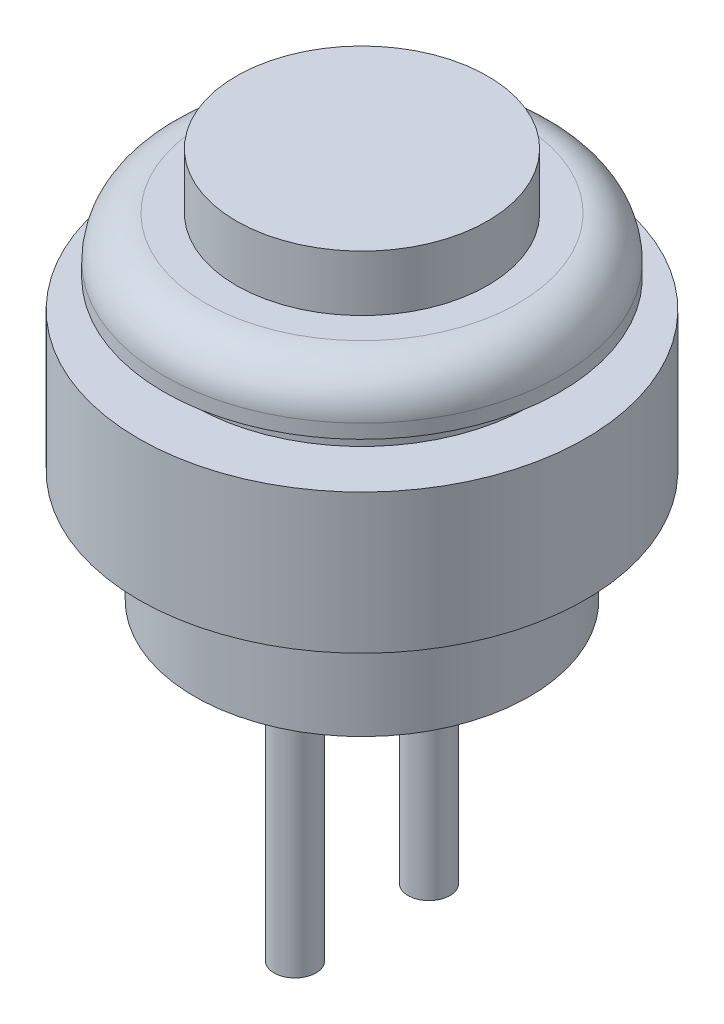
from build123d import *

# Parameters (mm, degrees)
SKETCH_1_R      = 7.1
EXTRUDE_1_DEPTH = 2
FILLET_1_R      = 1.5
SKETCH_2_R      = 4.5
EXTRUDE_2_DEPTH = 2
SKETCH_3_R      = 6
EXTRUDE_3_DEPTH = 10
SKETCH_4_R      = 0.75
EXTRUDE_4_DEPTH = 10
SKETCH_5_R      = 8
SKETCH_5_R_2    = 6
EXTRUDE_5_DEPTH = 5


with BuildPart() as part:
    # 草图1 → 拉伸1 (new body)
    with BuildSketch(Plane(origin=(0, 0, 0), x_dir=(1, 0, 0), z_dir=(0, 1, 0))):
        Circle(SKETCH_1_R)
    extrude(amount=EXTRUDE_1_DEPTH)

    # 圆角1
    fillet_1_edges = [part.edges().sort_by_distance(p)[0] for p in [
        (-7.1, 2, 0),
    ]]
    fillet(fillet_1_edges, radius=FILLET_1_R)

    # 草图2 → 拉伸2 (add)
    with BuildSketch(Plane(origin=(0, 2, 0), x_dir=(-1, 0, 0), z_dir=(0, 1, 0))):
        Circle(SKETCH_2_R)
    extrude(amount=EXTRUDE_2_DEPTH)

    # 草图3 → 拉伸3 (add)
    with BuildSketch(Plane.XZ):
        Circle(SKETCH_3_R)
    extrude(amount=EXTRUDE_3_DEPTH)

    # 草图4 → 拉伸4 (add)
    with BuildSketch(Plane.XZ.offset(10)):
        with Locations((0, -2.4)):
            Circle(SKETCH_4_R)
        with Locations((0, 2.4)):
            Circle(SKETCH_4_R)
    extrude(amount=EXTRUDE_4_DEPTH)

    # 草图5 → 拉伸5 (add)
    with BuildSketch(Plane.XZ.offset(1)):
        Circle(SKETCH_5_R)
        Circle(SKETCH_5_R_2, mode=Mode.SUBTRACT)
    extrude(amount=EXTRUDE_5_DEPTH)


solid = part.part
